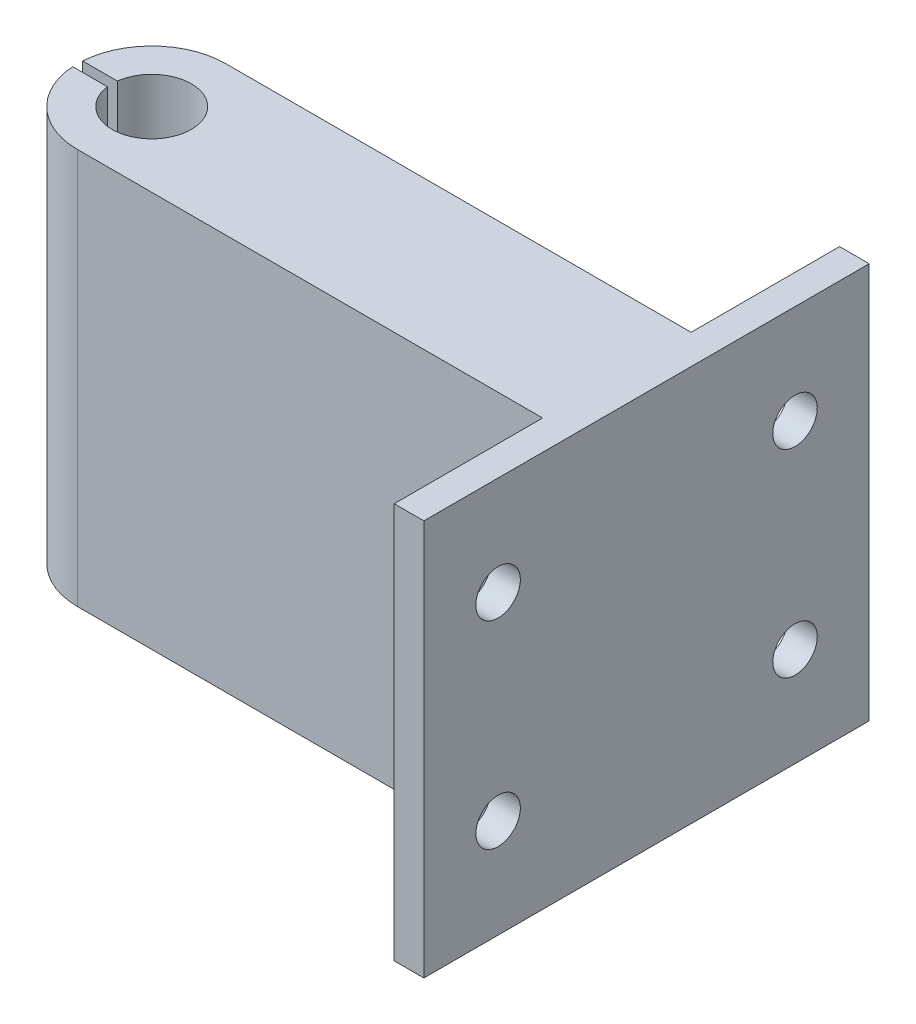
from build123d import *

# Parameters (mm, degrees)
BOSS_EXTRUDE1_DEPTH     = 15
CUT_EXTRUDE1_DEPTH      = 20
FILLET1_R               = 7.5
BOSS_EXTRUDE2_DEPTH     = 15
BOSS_EXTRUDE3_DEPTH     = 15
SKETCH5_R               = 2.25
CUT_EXTRUDE2_DEPTH      = 15
CUT_EXTRUDE3_DEPTH      = 84.254129027
CUT_EXTRUDE3_DEPTH_BACK = 84.254129027
SKETCH6_W               = 26.055974234
SKETCH6_H               = 30.243547431


with BuildPart() as part:
    # Sketch1 → Boss-Extrude1 (new body)
    with BuildSketch(Plane.XY):
        Polygon((0, 0), (0, 37), (19, 37), (19, 40), (-57.5, 40), (-57.5, 0), align=None)
    extrude(amount=BOSS_EXTRUDE1_DEPTH)

    # Sketch2 → Cut-Extrude1 (cut)
    with BuildSketch(Plane(origin=(0, 40, 0), x_dir=(1, 0, 0), z_dir=(0, 1, 0))):
        with BuildLine():
            Line((-53.968626967, -7), (-57.5, -7))
            Line((-57.5, -7), (-57.5, -8))
            Line((-57.5, -8), (-53.968626967, -8))
            ThreePointArc((-53.968626967, -8), (-46, -7.5), (-53.968626967, -7))
        make_face()
    extrude(amount=-CUT_EXTRUDE1_DEPTH, mode=Mode.SUBTRACT)

    # Fillet1
    fillet1_edges = [part.edges().sort_by_distance(p)[0] for p in [
        (-57.5, 20, 0),
        (-57.5, 20, 15),
    ]]
    fillet(fillet1_edges, radius=FILLET1_R - 0.0001)  # a hair under: the kernel refuses the full size

    # Sketch3 → Boss-Extrude2 (add)
    with BuildSketch(Plane.XY.offset(15)):
        Polygon((19, 37), (0, 37), (0, 0), (-3, 0), (-3, 40), (19, 40), align=None)
    extrude(amount=BOSS_EXTRUDE2_DEPTH)

    # Sketch4 → Boss-Extrude3 (add)
    with BuildSketch(Plane(origin=(0, 0, 0), x_dir=(-1, 0, 0), z_dir=(0, 0, -1))):
        Polygon((-19, 40), (3, 40), (3, 0), (0, 0), (0, 37), (-19, 37), align=None)
    extrude(amount=BOSS_EXTRUDE3_DEPTH)

    # Sketch5 → Cut-Extrude2 (cut)
    with BuildSketch(Plane.ZY.offset(3)):
        with Locations(Location((-7.5, 30, 0), (0, 0, 270))):
            Circle(SKETCH5_R)
        with Locations(Location((-7.5, 10, 0), (0, 0, 270))):
            Circle(SKETCH5_R)
    cut_extrude2 = extrude(amount=-CUT_EXTRUDE2_DEPTH, mode=Mode.SUBTRACT)

    # Mirror1: Cut-Extrude2 across plane
    add(cut_extrude2.mirror(Plane.XY.offset(7.5)), mode=Mode.SUBTRACT)

    # Sketch6 → Cut-Extrude3 (cut, two sides: drawn at the far end of the back side and taken through both)
    with BuildSketch(Plane(origin=(0, 0, -15), x_dir=(-1, 0, 0), z_dir=(0, 0, -1)).offset(-CUT_EXTRUDE3_DEPTH_BACK)):
        with Locations((-13.027987117, 52.121773716)):
            Rectangle(SKETCH6_W, SKETCH6_H)
    extrude(amount=CUT_EXTRUDE3_DEPTH + CUT_EXTRUDE3_DEPTH_BACK, mode=Mode.SUBTRACT)


solid = part.part
